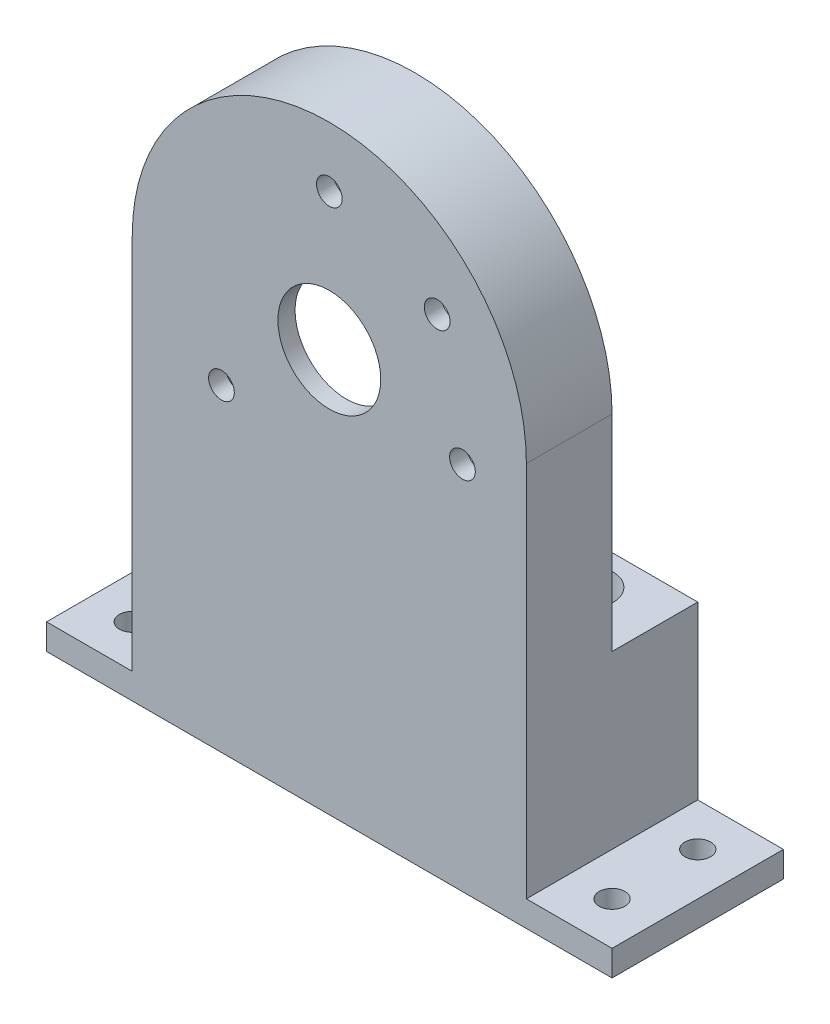
from build123d import *

# Parameters (mm, degrees)
EXTRUDE_1_DEPTH     = 20
CUT_EXTRUDE_1_DEPTH = 10
SKETCH_3_R          = 21
CUT_EXTRUDE_2_DEPTH = 8
SKETCH_7_R          = 1.5
CUT_EXTRUDE_6_DEPTH = 3
SKETCH_8_R          = 6
CUT_EXTRUDE_7_DEPTH = 3
SKETCH_12_W         = 46
SKETCH_12_H         = 20
EXTRUDE_4_DEPTH     = 20
SKETCH_13_R         = 3.1
CUT_EXTRUDE_8_DEPTH = 20
SKETCH_14_W         = 10
SKETCH_14_H         = 20
SKETCH_14_R         = 1.5
EXTRUDE_5_DEPTH     = 3
SKETCH_15_R         = 1.5
CUT_EXTRUDE_9_DEPTH = 78.31752712


with BuildPart() as part:
    # 草图1 → 凸台-拉伸1 (new body)
    with BuildSketch(Plane.XY):
        with BuildLine():
            Line((-23, 0), (-23, -27))
            Line((-23, -27), (23, -27))
            Line((23, -27), (23, 0))
            ThreePointArc((23, 0), (0, 23), (-23, 0))
        make_face()
    extrude(amount=EXTRUDE_1_DEPTH)

    # 草图2 → 切除-拉伸1 (cut)
    with BuildSketch(Plane(origin=(0, 0, 0), x_dir=(-1, 0, 0), z_dir=(0, 0, -1))):
        with BuildLine():
            Line((-23, -24), (23, -24))
            Line((23, -24), (23, 0))
            ThreePointArc((23, 0), (0, 23), (-23, 0))
            Line((-23, 0), (-23, -24))
        make_face()
    extrude(amount=-CUT_EXTRUDE_1_DEPTH, mode=Mode.SUBTRACT)

    # 草图3 → 切除-拉伸2 (cut)
    with BuildSketch(Plane(origin=(0, 0, 10), x_dir=(-1, 0, 0), z_dir=(0, 0, -1))):
        Circle(SKETCH_3_R)
    extrude(amount=-CUT_EXTRUDE_2_DEPTH, mode=Mode.SUBTRACT)

    # 草图7 → 切除-拉伸6 (cut)
    with BuildSketch(Plane.XY.offset(20)):
        with Locations((0, 16)):
            Circle(SKETCH_7_R)
        with Locations((12.589057749, 9.875)):
            Circle(SKETCH_7_R)
        with Locations((-12.589057749, -9.875)):
            Circle(SKETCH_7_R)
        with Locations((15.539618159, -3.810546875)):
            Circle(SKETCH_7_R)
    extrude(amount=-CUT_EXTRUDE_6_DEPTH, mode=Mode.SUBTRACT)

    # 草图8 → 切除-拉伸7 (cut)
    with BuildSketch(Plane(origin=(0, 0, 18), x_dir=(-1, 0, 0), z_dir=(0, 0, -1))):
        Circle(SKETCH_8_R)
    extrude(amount=-CUT_EXTRUDE_7_DEPTH, mode=Mode.SUBTRACT)

    # 草图12 → 凸台-拉伸4 (add)
    with BuildSketch(Plane.XZ.offset(27)):
        with Locations((0, 10)):
            Rectangle(SKETCH_12_W, SKETCH_12_H)
    extrude(amount=EXTRUDE_4_DEPTH)

    # 草图13 → 切除-拉伸8 (cut)
    with BuildSketch(Plane(origin=(0, -24, 0), x_dir=(1, 0, 0), z_dir=(0, 1, 0))):
        with Locations((15, -5)):
            Circle(SKETCH_13_R)
        with Locations((-15, -5)):
            Circle(SKETCH_13_R)
    extrude(amount=-CUT_EXTRUDE_8_DEPTH, mode=Mode.SUBTRACT)

    # 草图14 → 凸台-拉伸5 (add)
    # profile 1 of 2: a face of its own
    with BuildSketch(Plane.XZ.offset(47)):
        with Locations((28, 10)):
            Rectangle(SKETCH_14_W, SKETCH_14_H)
        with Locations((28, 5)):
            Circle(SKETCH_14_R, mode=Mode.SUBTRACT)
        with Locations((28, 15)):
            Circle(SKETCH_14_R, mode=Mode.SUBTRACT)
    # profile 2 of 2: a face of its own
    with BuildSketch(Plane.XZ.offset(47)):
        with Locations((-28, 10)):
            Rectangle(SKETCH_14_W, SKETCH_14_H)
        with Locations((-28, 5)):
            Circle(SKETCH_14_R, mode=Mode.SUBTRACT)
        with Locations((-28, 15)):
            Circle(SKETCH_14_R, mode=Mode.SUBTRACT)
    extrude(amount=-EXTRUDE_5_DEPTH)

    # 草图15 → 切除-拉伸9 (cut, through all)
    with BuildSketch(Plane(origin=(0, -44, 0), x_dir=(1, 0, 0), z_dir=(0, 1, 0))):
        with Locations((-15, -5)):
            Circle(SKETCH_15_R)
        with Locations((15, -5)):
            Circle(SKETCH_15_R)
    extrude(amount=-CUT_EXTRUDE_9_DEPTH, mode=Mode.SUBTRACT)


solid = part.part
